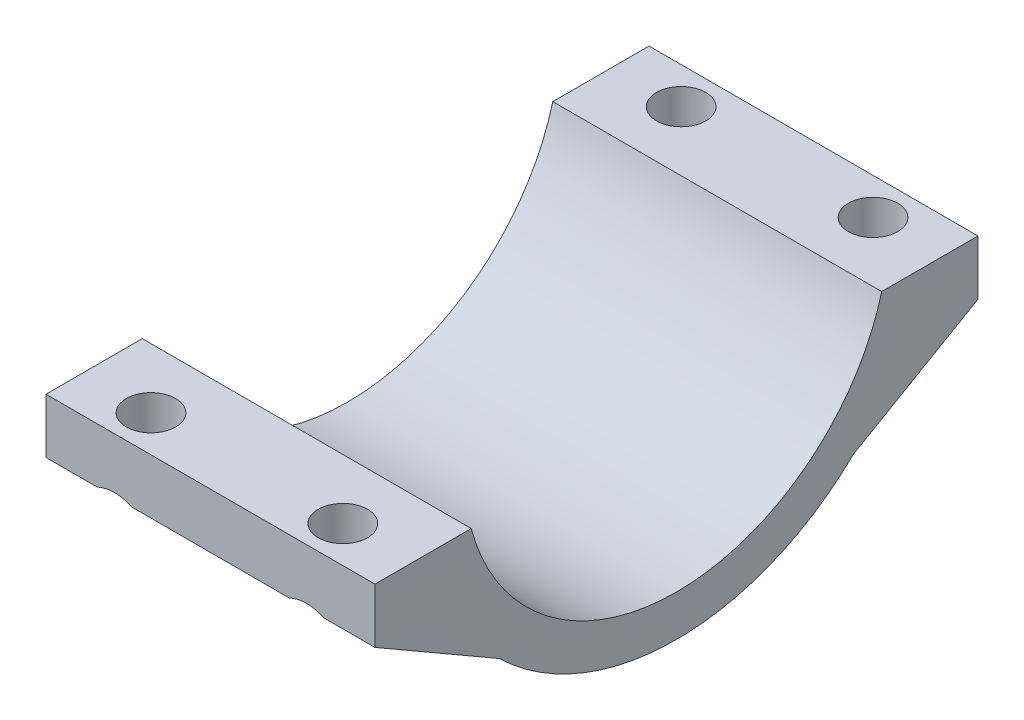
from build123d import *

# Parameters (mm, degrees)
EXTRUDE_1_DEPTH          = 24
RIB_1_REACH              = 39.447
SKETCH_3_WALL_W          = 87.38187838
SKETCH_3_WALL_H          = 2
RIB_2_REACH              = 33.149
SKETCH_4_WALL_W          = 74.786293516
SKETCH_4_WALL_H          = 8
HOLE_WIZARD_1_AT_2_COUNT = 2
HOLE_WIZARD_1_AT_2_PITCH = 14
MIRROR_2_COPY_1_REACH    = 39.447
MIRROR_2_COPY_1_SKETCH_W = 87.38187838
MIRROR_2_COPY_1_SKETCH_H = 2


with BuildPart() as part:
    # 草图1 → 凸台-拉伸1 (new body)
    with BuildSketch(Plane(origin=(0, 0, 0), x_dir=(0, 0, -1), z_dir=(1, 0, 0))):
        with BuildLine():
            Line((-22, -4), (-14.974979132, -4))
            ThreePointArc((-14.974979132, -4), (0, -15.5), (14.974979132, -4))
            Line((14.974979132, -4), (22, -4))
            Line((22, -4), (22, -8))
            Line((22, -8), (16.680827318, -8))
            ThreePointArc((16.680827318, -8), (0, -18.5), (-16.680827318, -8))
            Line((-16.680827318, -8), (-22, -8))
            Line((-22, -8), (-22, -4))
        make_face()
    extrude(amount=EXTRUDE_1_DEPTH)

    # 草图3 wall → 筋1 (add, up to next)
    with BuildSketch(Plane(origin=(0, -10.622155252, 17.458293879), x_dir=(0, -0.500000000025, -0.86602540377), z_dir=(0, -0.86602540377, 0.500000000025)), mode=Mode.PRIVATE) as rib_1_sk1:
        with Locations((0, 1)):
            Rectangle(SKETCH_3_WALL_W, SKETCH_3_WALL_H)
    rib_1_tool1 = extrude(rib_1_sk1.sketch, amount=-RIB_1_REACH, mode=Mode.PRIVATE) - part.part
    rib_1 = rib_1_tool1.solids().sort_by_distance((0, -10.622155252, 17.458293879))[0]
    add(rib_1)

    # 草图4 wall → 筋2 (add, up to next)
    with BuildSketch(Plane(origin=(12, -10.622155252, 17.458293879), x_dir=(0, -0.500000000025, -0.86602540377), z_dir=(0, -0.86602540377, 0.500000000025)), mode=Mode.PRIVATE) as rib_2_sk1:
        Rectangle(SKETCH_4_WALL_W, SKETCH_4_WALL_H)
    rib_2_tool1 = extrude(rib_2_sk1.sketch, amount=-RIB_2_REACH, mode=Mode.PRIVATE) - part.part
    rib_2 = rib_2_tool1.solids().sort_by_distance((12, -10.622155252, 17.458293879))[0]
    add(rib_2)

    # 镜向1: 筋1 across plane
    add(rib_1.mirror(Plane.ZY.offset(-12)))

    # 草图6 → 打孔尺寸(%根据十字)槽沉头木螺钉的类型1 (revolve, cut)
    with BuildSketch(Plane(origin=(19, -8, 19.340413659), x_dir=(0, 0, -1), z_dir=(1, 0, 0))):
        Polygon((0, 0), (0, 6.081549114), (1.8, 5), (1.8, 1.15), (2.95, 0), align=None)
    hole_wizard_1 = revolve(axis=Axis((19, -14.35, 19.340413659), (0, 1, 0)), mode=Mode.SUBTRACT)

    # 打孔尺寸(%根据十字)槽沉头木螺钉的类型1 at 2: 打孔尺寸(%根据十字)槽沉头木螺钉的类型1 ×2
    with Locations(*[(-i * HOLE_WIZARD_1_AT_2_PITCH, 0, 0) for i in range(1, HOLE_WIZARD_1_AT_2_COUNT)]):
        add(hole_wizard_1, mode=Mode.SUBTRACT)

    # 镜向2: 筋1, 筋2, 打孔尺寸(%根据十字)槽沉头木螺钉的类型1 across plane
    add(rib_1.mirror(Plane.XY))
    add(rib_2.mirror(Plane.XY))
    add(hole_wizard_1.mirror(Plane.XY), mode=Mode.SUBTRACT)

    # 镜向2 copy 1 sketch → 镜向2 copy 1 (add, up to next)
    with BuildSketch(Plane(origin=(24, -10.622155252, -17.458293879), x_dir=(0, -0.500000000025, 0.86602540377), z_dir=(0, -0.86602540377, -0.500000000025)), mode=Mode.PRIVATE) as mirror_2_copy_1_sk1:
        with Locations((0, 1)):
            Rectangle(MIRROR_2_COPY_1_SKETCH_W, MIRROR_2_COPY_1_SKETCH_H)
    mirror_2_copy_1_tool1 = extrude(mirror_2_copy_1_sk1.sketch, amount=-MIRROR_2_COPY_1_REACH, mode=Mode.PRIVATE) - part.part
    add(mirror_2_copy_1_tool1.solids().sort_by_distance((24, -10.622155252, -17.458293879))[0])

    # 镜向2 copy 2 sketch → 镜向2 copy 2 (revolve, cut)
    with BuildSketch(Plane(origin=(5, -8, -19.340413659), x_dir=(0, 0, 1), z_dir=(1, 0, 0))):
        Polygon((0, 0), (0, -6.081549114), (1.8, -5), (1.8, -1.15), (2.95, 0), align=None)
    revolve(axis=Axis((5, -14.35, -19.340413659), (0, -1, 0)), mode=Mode.SUBTRACT)


solid = part.part
